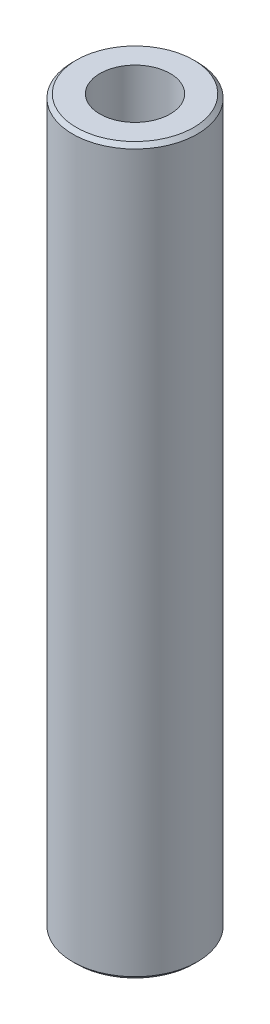
from build123d import *

# Parameters (mm, degrees)
SKETCH1_R           = 45
BOSS_EXTRUDE1_DEPTH = 522.837022471
SKETCH2_R           = 25.359490769
CUT_EXTRUDE1_DEPTH  = 527.695881953
CHAMFER1_SIZE       = 2.741362442


with BuildPart() as part:
    # Sketch1 → Boss-Extrude1 (new body)
    with BuildSketch(Plane(origin=(0, 0, 0), x_dir=(1, 0, 0), z_dir=(0, 1, 0))):
        Circle(SKETCH1_R)
    extrude(amount=BOSS_EXTRUDE1_DEPTH)

    # Sketch2 → Cut-Extrude1 (cut, through all)
    with BuildSketch(Plane(origin=(0, 0, 0), x_dir=(1, 0, 0), z_dir=(0, 1, 0))):
        Circle(SKETCH2_R)
    extrude(amount=CUT_EXTRUDE1_DEPTH, mode=Mode.SUBTRACT)

    # Chamfer1
    chamfer1_edges = [part.edges().sort_by_distance(p)[0] for p in [
        (-45, 522.837022471, 0),
        (-45, 0, 0),
    ]]
    chamfer(chamfer1_edges, length=CHAMFER1_SIZE)


solid = part.part
